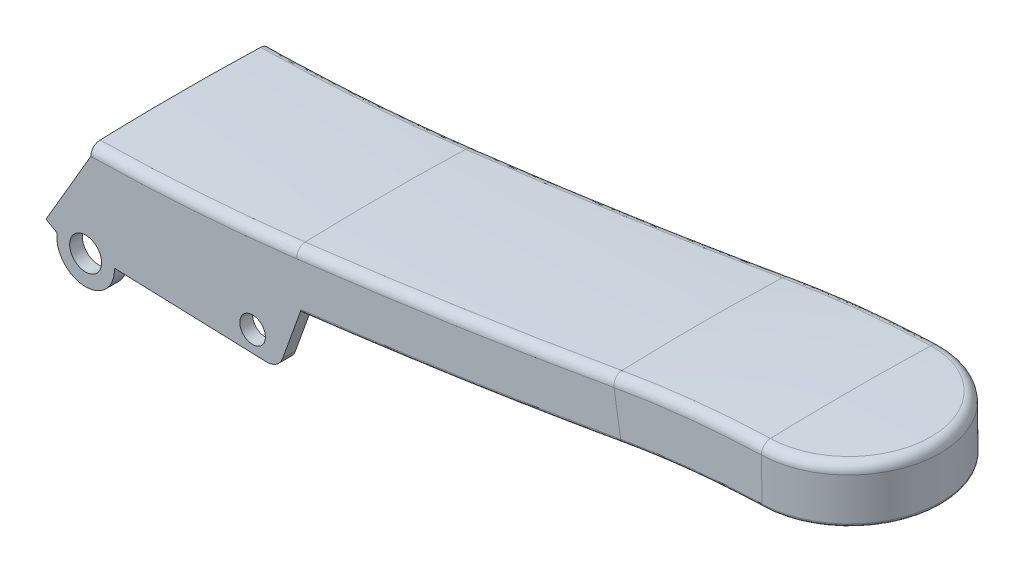
from build123d import *

# Parameters (mm, degrees)
REVOLU_O1_ANGLE          = 180
RESSALTO_EXTRUS_O1_DEPTH = 2
ESBO_O7_R                = 2.5
CORTE_EXTRUS_O1_DEPTH    = 125.056805494
ESBO_O8_R                = 2
CORTE_EXTRUS_O2_DEPTH    = 125.056805494


with BuildPart() as part:
    # Varredura1: sweep along a path in Esboço1
    with BuildLine(Plane.XY) as varredura1_path:
        ThreePointArc((0, 0), (16.529462147, 0.705444386), (33, 2.268183475))
        ThreePointArc((33, 2.268183475), (58.050044629, 5.646181244), (83, 9.697765111))
        ThreePointArc((83, 9.697765111), (93.959586917, 11.235067223), (105, 12))
    # Esboço2 → Varredura1 (sweep)
    with BuildSketch(Plane(origin=(0, 0, 0), x_dir=(0, 0, -1), z_dir=(1, 0, 0))):
        with BuildLine():
            Line((-14, 7.442730927), (-14, 0.894376808))
            ThreePointArc((-14, 0.894376808), (-13.5, 0.394376808), (-13, 0.894376808))
            Line((-13, 0.894376808), (-13, 6.736019744))
            ThreePointArc((-13, 6.736019744), (-12.74508542, 7.380356175), (-12.118337614, 7.675886319))
            ThreePointArc((-12.118337614, 7.675886319), (-6.062261288, 7.966491733), (0, 8.063959997))
            ThreePointArc((0, 8.063959997), (6.062261288, 7.966491733), (12.118337614, 7.675886319))
            ThreePointArc((12.118337614, 7.675886319), (12.74508542, 7.380356175), (13, 6.736019744))
            Line((13, 6.736019744), (13, 0.894376808))
            ThreePointArc((13, 0.894376808), (13.5, 0.394376808), (14, 0.894376808))
            Line((14, 0.894376808), (14, 7.442730927))
            ThreePointArc((14, 7.442730927), (13.576954157, 8.486842866), (12.546440343, 8.942011852))
            ThreePointArc((12.546440343, 8.942011852), (0, 9.136278747), (-12.546440343, 8.942011852))
            ThreePointArc((-12.546440343, 8.942011852), (-13.576954157, 8.486842866), (-14, 7.442730927))
        make_face()
    sweep(path=varredura1_path.line)

    # Esboço3 → Revolução1 (revolve)
    with BuildSketch(Plane(origin=(105.176984905, 1.830436311, 0), x_dir=(0, 0, -1), z_dir=(0.9998485953632164, 0.01740075717327509, 0))):
        with BuildLine():
            Line((14, 17.613834568), (14, 11.065480449))
            ThreePointArc((14, 11.065480449), (13.5, 10.565480449), (13, 11.065480449))
            Line((13, 11.065480449), (13, 16.907123386))
            ThreePointArc((13, 16.907123386), (12.74508542, 17.551459816), (12.118337614, 17.84698996))
            ThreePointArc((12.118337614, 17.84698996), (6.062261288, 18.137595374), (0, 18.235063639))
            Line((0, 18.235063639), (0, 19.307382388))
            ThreePointArc((0, 19.307382388), (6.273972125, 19.258812754), (12.546440343, 19.113115494))
            ThreePointArc((12.546440343, 19.113115494), (13.576954157, 18.657946508), (14, 17.613834568))
        make_face()
    revolve(axis=Axis((104.841021832, 21.134895472, 0), (0.017400757173274935, -0.9998485953632164, 0)), revolution_arc=REVOLU_O1_ANGLE)

    # Esboço6 → Ressalto-extrusão1 (add)
    with BuildSketch(Plane.XY.offset(14)):
        with BuildLine():
            Line((0, 7.442730927), (-7, -4.557269073))
            Line((-7, -4.557269073), (-5.272442198, -5.565011124))
            ThreePointArc((-5.272442198, -5.565011124), (-0.943881137, -10.614607271), (3.685022716, -5.838823437))
            Line((3.685022716, -5.838823437), (27.464771889, -6.644799062))
            ThreePointArc((27.464771889, -6.644799062), (29.011913143, -6.198294277), (29.999382133, -4.926320387))
            Line((29.999382133, -4.926320387), (32.907249231, 3.157737954))
            Line((32.907249231, 3.157737954), (32.2281564, 9.670784444))
            ThreePointArc((32.2281564, 9.670784444), (16.14315941, 8.136106307), (0, 7.442730927))
        make_face()
    ressalto_extrus_o1 = extrude(amount=-RESSALTO_EXTRUS_O1_DEPTH)

    # Espelhar1: Ressalto-extrusão1 across plane
    add(ressalto_extrus_o1.mirror(Plane.XY))

    # Esboço7 → Corte-extrusão1 (cut, through all)
    with BuildSketch(Plane.XY.offset(14)):
        with Locations((-0.806389095, -6.116708213)):
            Circle(ESBO_O7_R)
    extrude(amount=-CORTE_EXTRUS_O1_DEPTH, mode=Mode.SUBTRACT)

    # Esboço8 → Corte-extrusão2 (cut, through all)
    with BuildSketch(Plane.XY.offset(14)):
        with Locations((25.307249231, -3.369835879)):
            Circle(ESBO_O8_R)
    extrude(amount=-CORTE_EXTRUS_O2_DEPTH, mode=Mode.SUBTRACT)


solid = part.part
